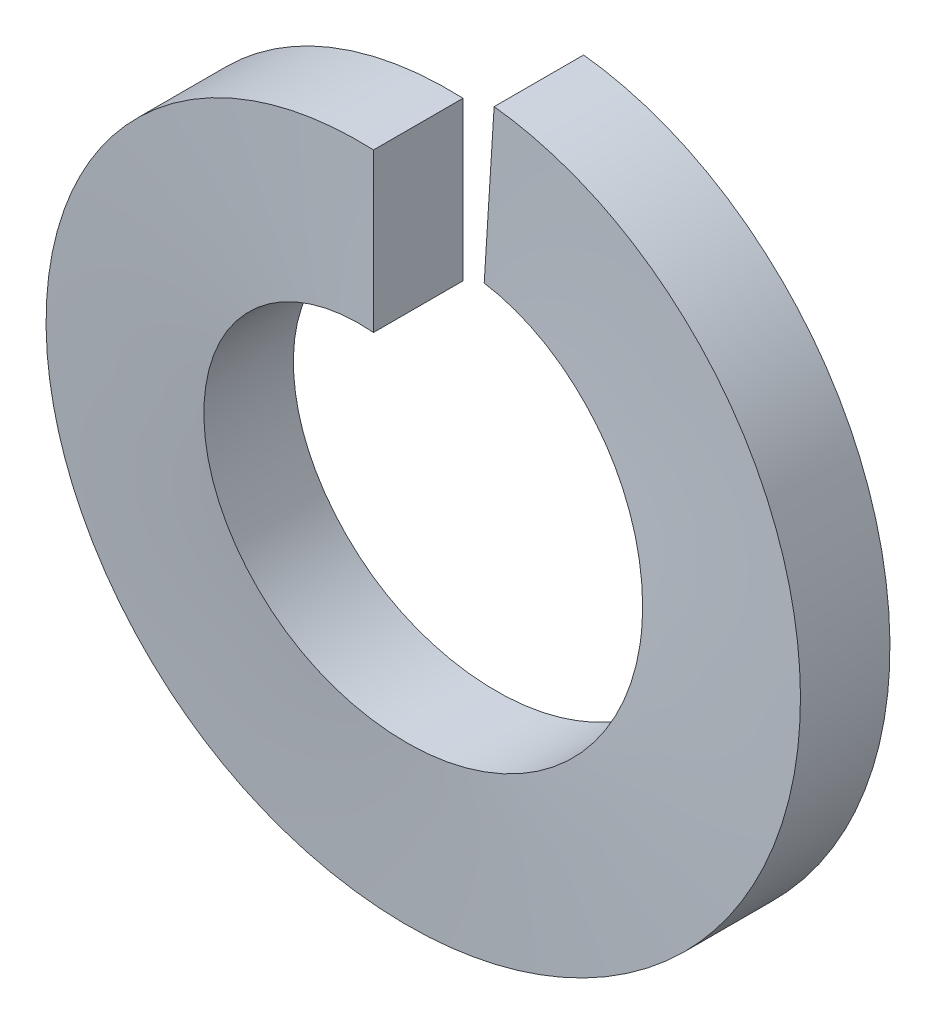
from build123d import *

# Parameters (mm, degrees)
SWEEP1_PITCH = 1.666666667


with BuildPart() as part:
    # Sweep1: the profile of Sketch2 screwed along a left-hand helix of 0.99 turns, 8 arcs to a turn; built about Z, then put on its axis
    sweep1_z = Axis((0, 0, 0), (0, 0, 1))
    sweep1_corners = [(5.9, 0, 0), (5.9, 0, -1.5), (3.25, 0, -1.5), (3.25, 0, 0)]
    with BuildLine(mode=Mode.PRIVATE) as sweep1_profile:
        Line(sweep1_corners[0], sweep1_corners[1])
        Line(sweep1_corners[1], sweep1_corners[2])
        Line(sweep1_corners[2], sweep1_corners[3])
        Line(sweep1_corners[3], sweep1_corners[0])
    sweep1_cap = Face(sweep1_profile.wire())
    sweep1_turn_angles = [0, -22.5, -45, -67.5, -90, -112.5, -135, -157.5, -180, -202.5, -225, -247.5, -270, -292.5, -315, -335.7, -356.4]
    sweep1_turn_weights = [1, 0.9238795325112867, 1, 0.9238795325112867, 1, 0.9238795325112867, 1, 0.9238795325112867, 1, 0.9238795325112867, 1, 0.9238795325112867, 1, 0.9238795325112867, 1, 0.9354440308298649, 1]
    sweep1_turn_rails = [Edge.make_bspline([Vector(p[0], p[1], 0).rotate(sweep1_z, sweep1_turn_angles[k]) / sweep1_turn_weights[k] + Vector(0, 0, p[2] + -SWEEP1_PITCH * sweep1_turn_angles[k] / 360) for k in range(17)], [0, 0, 0, 1, 1, 2, 2, 3, 3, 4, 4, 5, 5, 6, 6, 7, 7, 8, 8, 8], 2, sweep1_turn_weights) for p in sweep1_corners]
    sweep1_turn_sides = [Face.make_surface_from_curves(sweep1_turn_rails[p[0]], sweep1_turn_rails[p[1]]) for p in [(0, 1), (1, 2), (2, 3), (3, 0)]]
    sweep1 = Plane(origin=(0, 0, 0), x_dir=(0, 1, 0), z_dir=(0, 0, -1)) * Solid(Shell([*sweep1_turn_sides, sweep1_cap, sweep1_cap.rotate(sweep1_z, -356.4).moved(Location((0, 0, -SWEEP1_PITCH * -356.4 / 360)))]))
    add(sweep1)


solid = part.part
